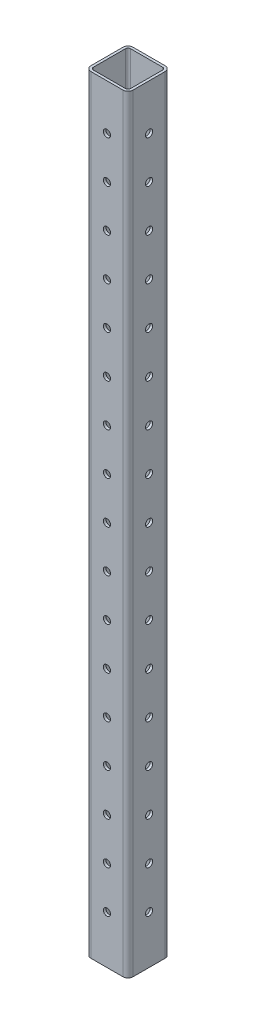
from build123d import *

# Parameters (mm, degrees)
ESQUISSE1_W                             = 50
ESQUISSE1_H                             = 50
ESQUISSE1_W_2                           = 44
ESQUISSE1_H_2                           = 44
BOSS_EXTRU_1_DEPTH                      = 911
PER_AGE2_START                          = -25
PER_AGE2_OUTLINE_R                      = 4.25
PER_AGE2_DEPTH                          = 50
R_P_TITION_LIN_AIRE1_COUNT              = 17
R_P_TITION_LIN_AIRE1_PITCH              = 50
R_P_TITION_CIRCULAIRE1_COUNT            = 2
R_P_TITION_CIRCULAIRE1_ANGLE            = 90
R_P_TITION_START                        = -25
R_P_TITION_CIRCULAIRE1_COPY_1_SKETCH_R  = 4.25
R_P_TITION_CIRCULAIRE1_COPY_1_DEPTH     = 50
R_P_TITION_CIRCULAIRE1_COPY_2_SKETCH_R  = 4.25
R_P_TITION_CIRCULAIRE1_COPY_2_DEPTH     = 50
R_P_TITION_CIRCULAIRE1_COPY_3_SKETCH_R  = 4.25
R_P_TITION_CIRCULAIRE1_COPY_3_DEPTH     = 50
R_P_TITION_CIRCULAIRE1_COPY_4_SKETCH_R  = 4.25
R_P_TITION_CIRCULAIRE1_COPY_4_DEPTH     = 50
R_P_TITION_CIRCULAIRE1_COPY_5_SKETCH_R  = 4.25
R_P_TITION_CIRCULAIRE1_COPY_5_DEPTH     = 50
R_P_TITION_CIRCULAIRE1_COPY_6_SKETCH_R  = 4.25
R_P_TITION_CIRCULAIRE1_COPY_6_DEPTH     = 50
R_P_TITION_CIRCULAIRE1_COPY_7_SKETCH_R  = 4.25
R_P_TITION_CIRCULAIRE1_COPY_7_DEPTH     = 50
R_P_TITION_CIRCULAIRE1_COPY_8_SKETCH_R  = 4.25
R_P_TITION_CIRCULAIRE1_COPY_8_DEPTH     = 50
R_P_TITION_CIRCULAIRE1_COPY_9_SKETCH_R  = 4.25
R_P_TITION_CIRCULAIRE1_COPY_9_DEPTH     = 50
R_P_TITION_CIRCULAIRE1_COPY_10_SKETCH_R = 4.25
R_P_TITION_CIRCULAIRE1_COPY_10_DEPTH    = 50
R_P_TITION_CIRCULAIRE1_COPY_11_SKETCH_R = 4.25
R_P_TITION_CIRCULAIRE1_COPY_11_DEPTH    = 50
R_P_TITION_CIRCULAIRE1_COPY_12_SKETCH_R = 4.25
R_P_TITION_CIRCULAIRE1_COPY_12_DEPTH    = 50
R_P_TITION_CIRCULAIRE1_COPY_13_SKETCH_R = 4.25
R_P_TITION_CIRCULAIRE1_COPY_13_DEPTH    = 50
R_P_TITION_CIRCULAIRE1_COPY_14_SKETCH_R = 4.25
R_P_TITION_CIRCULAIRE1_COPY_14_DEPTH    = 50
R_P_TITION_CIRCULAIRE1_COPY_15_SKETCH_R = 4.25
R_P_TITION_CIRCULAIRE1_COPY_15_DEPTH    = 50
R_P_TITION_CIRCULAIRE1_COPY_16_SKETCH_R = 4.25
R_P_TITION_CIRCULAIRE1_COPY_16_DEPTH    = 50
CONG_3_R                                = 6
CONG_4_R                                = 3


# Read off the part's stored shape, not the designer's step: Perçage2
with BuildPart() as part:
    # Esquisse1 → Boss.-Extru.1 (new body)
    with BuildSketch(Plane(origin=(0, 0, 0), x_dir=(1, 0, 0), z_dir=(0, 1, 0))):
        Rectangle(ESQUISSE1_W, ESQUISSE1_H)
        Rectangle(ESQUISSE1_W_2, ESQUISSE1_H_2, mode=Mode.SUBTRACT)
    extrude(amount=BOSS_EXTRU_1_DEPTH)

    # Perçage2 outline → Perçage2 (cut)
    with BuildSketch(Plane.XY.offset(PER_AGE2_START)):
        with Locations((0, 57)):
            Circle(PER_AGE2_OUTLINE_R)
    per_age2 = extrude(amount=PER_AGE2_DEPTH, mode=Mode.SUBTRACT)

    # Répétition linéaire1: Perçage2 ×17
    with Locations(*[(0, i * R_P_TITION_LIN_AIRE1_PITCH, 0) for i in range(1, R_P_TITION_LIN_AIRE1_COUNT)]):
        add(per_age2, mode=Mode.SUBTRACT)

    # Répétition circulaire1: Perçage2 ×2 about axis
    r_p_tition_circulaire1_axis = Axis((0, 55, 0), (0, -1, 0))
    for i in range(1, R_P_TITION_CIRCULAIRE1_COUNT):
        add(per_age2.rotate(r_p_tition_circulaire1_axis, i * R_P_TITION_CIRCULAIRE1_ANGLE / (R_P_TITION_CIRCULAIRE1_COUNT - 1)), mode=Mode.SUBTRACT)

    # Répétition circulaire1 copy 1 sketch → Répétition circulaire1 copy 1 (cut)
    with BuildSketch(Plane(origin=(0, 50, 0), x_dir=(0, 0, 1), z_dir=(-1, 0, 0)).offset(R_P_TITION_START)):
        with Locations((0, 57)):
            Circle(R_P_TITION_CIRCULAIRE1_COPY_1_SKETCH_R)
    extrude(amount=R_P_TITION_CIRCULAIRE1_COPY_1_DEPTH, mode=Mode.SUBTRACT)

    # Répétition circulaire1 copy 2 sketch → Répétition circulaire1 copy 2 (cut)
    with BuildSketch(Plane(origin=(0, 100, 0), x_dir=(0, 0, 1), z_dir=(-1, 0, 0)).offset(R_P_TITION_START)):
        with Locations((0, 57)):
            Circle(R_P_TITION_CIRCULAIRE1_COPY_2_SKETCH_R)
    extrude(amount=R_P_TITION_CIRCULAIRE1_COPY_2_DEPTH, mode=Mode.SUBTRACT)

    # Répétition circulaire1 copy 3 sketch → Répétition circulaire1 copy 3 (cut)
    with BuildSketch(Plane(origin=(0, 150, 0), x_dir=(0, 0, 1), z_dir=(-1, 0, 0)).offset(R_P_TITION_START)):
        with Locations((0, 57)):
            Circle(R_P_TITION_CIRCULAIRE1_COPY_3_SKETCH_R)
    extrude(amount=R_P_TITION_CIRCULAIRE1_COPY_3_DEPTH, mode=Mode.SUBTRACT)

    # Répétition circulaire1 copy 4 sketch → Répétition circulaire1 copy 4 (cut)
    with BuildSketch(Plane(origin=(0, 200, 0), x_dir=(0, 0, 1), z_dir=(-1, 0, 0)).offset(R_P_TITION_START)):
        with Locations((0, 57)):
            Circle(R_P_TITION_CIRCULAIRE1_COPY_4_SKETCH_R)
    extrude(amount=R_P_TITION_CIRCULAIRE1_COPY_4_DEPTH, mode=Mode.SUBTRACT)

    # Répétition circulaire1 copy 5 sketch → Répétition circulaire1 copy 5 (cut)
    with BuildSketch(Plane(origin=(0, 250, 0), x_dir=(0, 0, 1), z_dir=(-1, 0, 0)).offset(R_P_TITION_START)):
        with Locations((0, 57)):
            Circle(R_P_TITION_CIRCULAIRE1_COPY_5_SKETCH_R)
    extrude(amount=R_P_TITION_CIRCULAIRE1_COPY_5_DEPTH, mode=Mode.SUBTRACT)

    # Répétition circulaire1 copy 6 sketch → Répétition circulaire1 copy 6 (cut)
    with BuildSketch(Plane(origin=(0, 300, 0), x_dir=(0, 0, 1), z_dir=(-1, 0, 0)).offset(R_P_TITION_START)):
        with Locations((0, 57)):
            Circle(R_P_TITION_CIRCULAIRE1_COPY_6_SKETCH_R)
    extrude(amount=R_P_TITION_CIRCULAIRE1_COPY_6_DEPTH, mode=Mode.SUBTRACT)

    # Répétition circulaire1 copy 7 sketch → Répétition circulaire1 copy 7 (cut)
    with BuildSketch(Plane(origin=(0, 350, 0), x_dir=(0, 0, 1), z_dir=(-1, 0, 0)).offset(R_P_TITION_START)):
        with Locations((0, 57)):
            Circle(R_P_TITION_CIRCULAIRE1_COPY_7_SKETCH_R)
    extrude(amount=R_P_TITION_CIRCULAIRE1_COPY_7_DEPTH, mode=Mode.SUBTRACT)

    # Répétition circulaire1 copy 8 sketch → Répétition circulaire1 copy 8 (cut)
    with BuildSketch(Plane(origin=(0, 400, 0), x_dir=(0, 0, 1), z_dir=(-1, 0, 0)).offset(R_P_TITION_START)):
        with Locations((0, 57)):
            Circle(R_P_TITION_CIRCULAIRE1_COPY_8_SKETCH_R)
    extrude(amount=R_P_TITION_CIRCULAIRE1_COPY_8_DEPTH, mode=Mode.SUBTRACT)

    # Répétition circulaire1 copy 9 sketch → Répétition circulaire1 copy 9 (cut)
    with BuildSketch(Plane(origin=(0, 450, 0), x_dir=(0, 0, 1), z_dir=(-1, 0, 0)).offset(R_P_TITION_START)):
        with Locations((0, 57)):
            Circle(R_P_TITION_CIRCULAIRE1_COPY_9_SKETCH_R)
    extrude(amount=R_P_TITION_CIRCULAIRE1_COPY_9_DEPTH, mode=Mode.SUBTRACT)

    # Répétition circulaire1 copy 10 sketch → Répétition circulaire1 copy 10 (cut)
    with BuildSketch(Plane(origin=(0, 500, 0), x_dir=(0, 0, 1), z_dir=(-1, 0, 0)).offset(R_P_TITION_START)):
        with Locations((0, 57)):
            Circle(R_P_TITION_CIRCULAIRE1_COPY_10_SKETCH_R)
    extrude(amount=R_P_TITION_CIRCULAIRE1_COPY_10_DEPTH, mode=Mode.SUBTRACT)

    # Répétition circulaire1 copy 11 sketch → Répétition circulaire1 copy 11 (cut)
    with BuildSketch(Plane(origin=(0, 550, 0), x_dir=(0, 0, 1), z_dir=(-1, 0, 0)).offset(R_P_TITION_START)):
        with Locations((0, 57)):
            Circle(R_P_TITION_CIRCULAIRE1_COPY_11_SKETCH_R)
    extrude(amount=R_P_TITION_CIRCULAIRE1_COPY_11_DEPTH, mode=Mode.SUBTRACT)

    # Répétition circulaire1 copy 12 sketch → Répétition circulaire1 copy 12 (cut)
    with BuildSketch(Plane(origin=(0, 600, 0), x_dir=(0, 0, 1), z_dir=(-1, 0, 0)).offset(R_P_TITION_START)):
        with Locations((0, 57)):
            Circle(R_P_TITION_CIRCULAIRE1_COPY_12_SKETCH_R)
    extrude(amount=R_P_TITION_CIRCULAIRE1_COPY_12_DEPTH, mode=Mode.SUBTRACT)

    # Répétition circulaire1 copy 13 sketch → Répétition circulaire1 copy 13 (cut)
    with BuildSketch(Plane(origin=(0, 650, 0), x_dir=(0, 0, 1), z_dir=(-1, 0, 0)).offset(R_P_TITION_START)):
        with Locations((0, 57)):
            Circle(R_P_TITION_CIRCULAIRE1_COPY_13_SKETCH_R)
    extrude(amount=R_P_TITION_CIRCULAIRE1_COPY_13_DEPTH, mode=Mode.SUBTRACT)

    # Répétition circulaire1 copy 14 sketch → Répétition circulaire1 copy 14 (cut)
    with BuildSketch(Plane(origin=(0, 700, 0), x_dir=(0, 0, 1), z_dir=(-1, 0, 0)).offset(R_P_TITION_START)):
        with Locations((0, 57)):
            Circle(R_P_TITION_CIRCULAIRE1_COPY_14_SKETCH_R)
    extrude(amount=R_P_TITION_CIRCULAIRE1_COPY_14_DEPTH, mode=Mode.SUBTRACT)

    # Répétition circulaire1 copy 15 sketch → Répétition circulaire1 copy 15 (cut)
    with BuildSketch(Plane(origin=(0, 750, 0), x_dir=(0, 0, 1), z_dir=(-1, 0, 0)).offset(R_P_TITION_START)):
        with Locations((0, 57)):
            Circle(R_P_TITION_CIRCULAIRE1_COPY_15_SKETCH_R)
    extrude(amount=R_P_TITION_CIRCULAIRE1_COPY_15_DEPTH, mode=Mode.SUBTRACT)

    # Répétition circulaire1 copy 16 sketch → Répétition circulaire1 copy 16 (cut)
    with BuildSketch(Plane(origin=(0, 800, 0), x_dir=(0, 0, 1), z_dir=(-1, 0, 0)).offset(R_P_TITION_START)):
        with Locations((0, 57)):
            Circle(R_P_TITION_CIRCULAIRE1_COPY_16_SKETCH_R)
    extrude(amount=R_P_TITION_CIRCULAIRE1_COPY_16_DEPTH, mode=Mode.SUBTRACT)

    # Congé3
    cong_3_edges = [part.edges().sort_by_distance(p)[0] for p in [
        (-25, 455.5, -25),
        (25, 455.5, -25),
        (25, 455.5, 25),
        (-25, 455.5, 25),
    ]]
    fillet(cong_3_edges, radius=CONG_3_R)

    # Congé4
    cong_4_edges = [part.edges().sort_by_distance(p)[0] for p in [
        (22, 455.5, -22),
        (-22, 455.5, -22),
        (-22, 455.5, 22),
        (22, 455.5, 22),
    ]]
    fillet(cong_4_edges, radius=CONG_4_R)


solid = part.part
